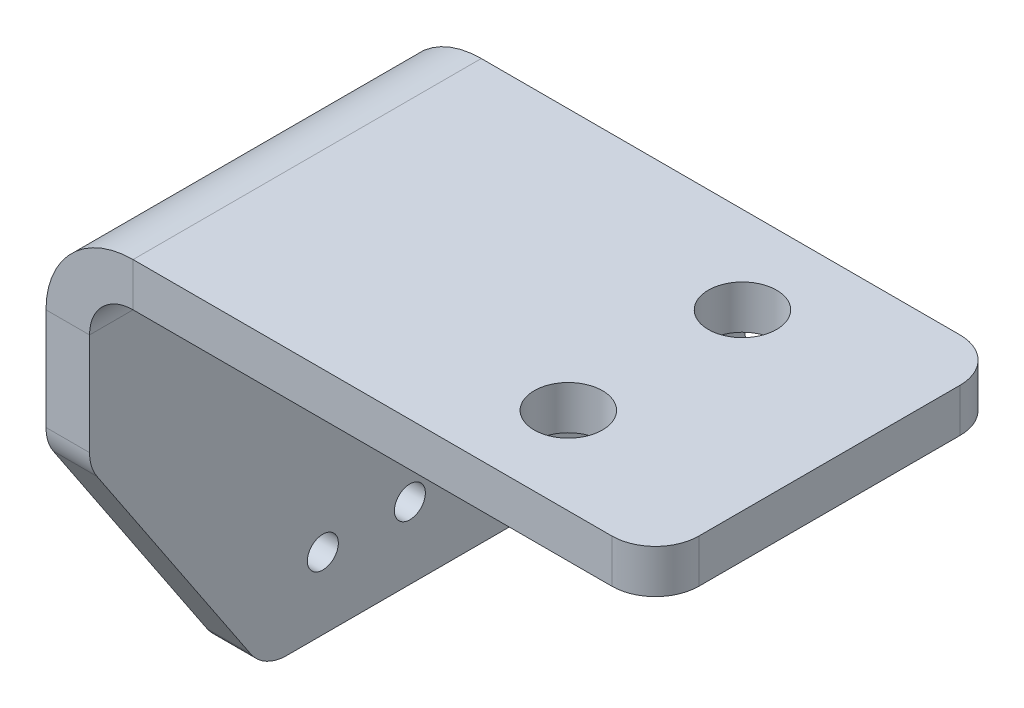
from build123d import *

# Parameters (mm, degrees)
SKETCH1_R                  = 2.4892
BOSS_EXTRUDE1_DEPTH        = 3.175
SKETCHED_START             = -52
SKETCHED_BEND2_DEPTH       = 52
SKETCHED_START_2           = -25.4
SKETCHED_BEND2_2_DEPTH     = 12.7
SKETCHED_START_3           = -41.835294118
SKETCHED_BEND2_3_OUTLINE_W = 3.175
SKETCHED_BEND2_3_OUTLINE_H = 12.7
SKETCHED_BEND2_3_DEPTH     = 16.435294118
SKETCHED_BEND2_4_DEPTH     = 20.459192
SKETCHED_START_4           = -50.8
SKETCHED_BEND2_5_OUTLINE_W = 3.175
SKETCHED_BEND2_5_OUTLINE_H = 12.7
SKETCHED_BEND2_5_DEPTH     = 48.117252
SKETCHED_START_5           = -4.940808
SKETCHED_BEND2_6_DEPTH     = 4.940808
SKETCHED_START_6           = -3.175
SKETCHED_BEND2_7_DEPTH     = 3.175
SKETCH13_R                 = 1.1303
CUT_EXTRUDE2_DEPTH         = 75.121324278
FILLET1_R                  = 3.175
SKETCH14_W                 = 20.670157998
SKETCH14_H                 = 6.985
CUT_EXTRUDE3_DEPTH         = 71.21778451
FILLET2_R                  = 3.175


with BuildPart() as part:
    # Sketch1 → Boss-Extrude1 (new body)
    # profile 1 of 2: a face of its own
    with BuildSketch(Plane(origin=(0, 0, 0), x_dir=(1, 0, 0), z_dir=(0, 1, 0))):
        Polygon((6.35, 0), (25.4, 0), (28.575, 0), (41.275, 0), (41.275, 25.4), (27.523477182, 25.4), (14.823477182, 25.4), (6.35, 25.4), align=None)
        with Locations(Location((28.575, 6.35, 0), (0, 0, 270))):
            Circle(SKETCH1_R, mode=Mode.SUBTRACT)
        with Locations(Location((28.575, 19.05, 0), (0, 0, 270))):
            Circle(SKETCH1_R, mode=Mode.SUBTRACT)
    # profile 2 of 2: a face of its own
    with BuildSketch(Plane(origin=(0, 0, 0), x_dir=(1, 0, 0), z_dir=(0, 1, 0))):
        Polygon((-12.7, 0), (6.35, 0), (6.35, 25.4), (0, 25.4), (-19.05, 25.4), (-19.05, 41.835294118), (-23.415467049, 44.91680027), (-31.75, 50.8), (-31.75, 12.7), (-23.415467049, 7.143644699), align=None)
    extrude(amount=BOSS_EXTRUDE1_DEPTH)

    # Sketched Bend2: read off the stored shape, not the designer's step
    # Sketched Bend2 outline → Sketched Bend2 (cut)
    with BuildSketch(Plane.XY.offset(SKETCHED_START)):
        with BuildLine():
            ThreePointArc((-2.324261315, 0), (-1e-09, 2.324261314), (3.175, 3.175))
            Line((3.175, 3.175), (-31.75, 3.175))
            Line((-31.75, 3.175), (-31.75, 0))
            Line((-31.75, 0), (-2.324261315, 0))
        make_face()
    extrude(amount=SKETCHED_BEND2_DEPTH, mode=Mode.SUBTRACT)

    # Sketched Bend2 2 outline → Sketched Bend2 2 (add)
    with BuildSketch(Plane.XY.offset(SKETCHED_START_2)):
        with BuildLine():
            ThreePointArc((-2.324261315, 0), (-2.958628997, -1.531499064), (-3.175, -3.175))
            Line((-3.175, -3.175), (-3.175, -30.619082494))
            Line((-3.175, -30.619082494), (0, -30.619082494))
            Line((0, -30.619082494), (0, -3.175))
            ThreePointArc((0, -3.175), (0.92993597, -0.92993597), (3.175, 0))
            Line((3.175, 0), (-2.324261315, 0))
        make_face()
    extrude(amount=SKETCHED_BEND2_2_DEPTH)

    # Sketched Bend2 3 outline → Sketched Bend2 3 (add)
    with BuildSketch(Plane.XY.offset(SKETCHED_START_3)):
        with Locations((-1.5875, -24.269082494)):
            Rectangle(SKETCHED_BEND2_3_OUTLINE_W, SKETCHED_BEND2_3_OUTLINE_H)
    extrude(amount=SKETCHED_BEND2_3_DEPTH)

    # Sketched Bend2 4 outline → Sketched Bend2 4 (add)
    with BuildSketch(Plane.XY.offset(SKETCHED_START_2)):
        with BuildLine():
            ThreePointArc((-2.324261315, 0), (-2.958628997, -1.531499064), (-3.175, -3.175))
            Line((-3.175, -3.175), (-3.175, -17.919082494))
            Line((-3.175, -17.919082494), (0, -17.919082494))
            Line((0, -17.919082494), (0, -3.175))
            ThreePointArc((0, -3.175), (0.92993597, -0.92993597), (3.175, 0))
            Line((3.175, 0), (-2.324261315, 0))
        make_face()
    extrude(amount=SKETCHED_BEND2_4_DEPTH)

    # Sketched Bend2 5 outline → Sketched Bend2 5 (add)
    with BuildSketch(Plane.XY.offset(SKETCHED_START_4)):
        with Locations((-1.5875, -24.269082494)):
            Rectangle(SKETCHED_BEND2_5_OUTLINE_W, SKETCHED_BEND2_5_OUTLINE_H)
    extrude(amount=SKETCHED_BEND2_5_DEPTH)

    # Sketched Bend2 6 outline → Sketched Bend2 6 (add)
    with BuildSketch(Plane.XY.offset(SKETCHED_START_5)):
        with BuildLine():
            ThreePointArc((-2.324261315, 0), (-2.958628997, -1.531499064), (-3.175, -3.175))
            Line((-3.175, -3.175), (-3.175, -17.919082494))
            Line((-3.175, -17.919082494), (0, -17.919082494))
            Line((0, -17.919082494), (0, -3.175))
            ThreePointArc((0, -3.175), (0.92993597, -0.92993597), (3.175, 0))
            Line((3.175, 0), (-2.324261315, 0))
        make_face()
    extrude(amount=SKETCHED_BEND2_6_DEPTH)

    # Sketched Bend2 7 outline → Sketched Bend2 7 (cut)
    with BuildSketch(Plane.YZ.offset(SKETCHED_START_6)):
        Polygon((-30.619082494, -2.682748), (-30.619082494, -12.7), (-11.569082494, 0), (-17.919082494, 0), (-17.919082494, -2.682748), align=None)
        Polygon((-17.919082494, -41.835294118), (-30.619082494, -50.8), (-17.919082494, -50.8), align=None)
    extrude(amount=SKETCHED_BEND2_7_DEPTH, mode=Mode.SUBTRACT)

    # Sketch13 → Cut-Extrude2 (cut, through all)
    with BuildSketch(Plane.ZY.offset(3.175)):
        with Locations(Location((-17.018, -25.4, 0), (0, 0, 270))):
            Circle(SKETCH13_R)
        with Locations(Location((-23.368, -25.4, 0), (0, 0, 270))):
            Circle(SKETCH13_R)
        with Locations(Location((-29.718, -25.4, 0), (0, 0, 270))):
            Circle(SKETCH13_R)
        with Locations(Location((-36.068, -25.4, 0), (0, 0, 270))):
            Circle(SKETCH13_R)
        with Locations(Location((-42.418, -25.4, 0), (0, 0, 270))):
            Circle(SKETCH13_R)
    extrude(amount=-CUT_EXTRUDE2_DEPTH, mode=Mode.SUBTRACT)

    # Fillet1
    fillet1_edges = [part.edges().sort_by_distance(p)[0] for p in [
        (-1.5875, -17.919082494, -41.835294118),
        (-1.5875, -17.919082494, -25.4),
        (-1.5875, -11.569082494, 0),
        (-1.5875, -30.619082494, -12.7),
        (-1.5875, -30.619082494, -50.8),
        (41.275, 1.5875, -25.4),
        (41.275, 1.5875, 0),
    ]]
    fillet(fillet1_edges, radius=FILLET1_R)

    # Sketch14 → Cut-Extrude3 (cut, through all)
    with BuildSketch(Plane(origin=(0, 0, 0), x_dir=(0, 0, -1), z_dir=(1, 0, 0))):
        with Locations((35.735078999, -18.236582494)):
            Rectangle(SKETCH14_W, SKETCH14_H)
    extrude(amount=-CUT_EXTRUDE3_DEPTH, mode=Mode.SUBTRACT)

    # Fillet2
    fillet2_edges = [part.edges().sort_by_distance(p)[0] for p in [
        (-1.5875, -21.729082494, -44.524705882),
        (-1.5875, -21.729082494, -25.4),
    ]]
    fillet(fillet2_edges, radius=FILLET2_R)


solid = part.part
